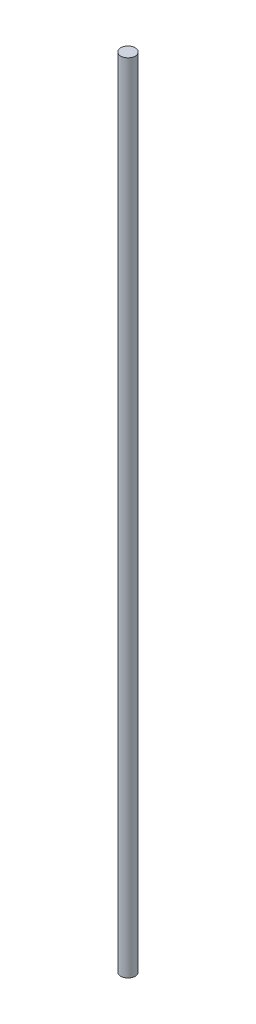
from build123d import *

# Parameters (mm, degrees)
SKETCH1_R           = 12.7
BOSS_EXTRUDE1_DEPTH = 1397


with BuildPart() as part:
    # Sketch1 → Boss-Extrude1 (new body)
    with BuildSketch(Plane(origin=(0, 0, 0), x_dir=(1, 0, 0), z_dir=(0, 1, 0))):
        Circle(SKETCH1_R)
    extrude(amount=BOSS_EXTRUDE1_DEPTH)


solid = part.part
